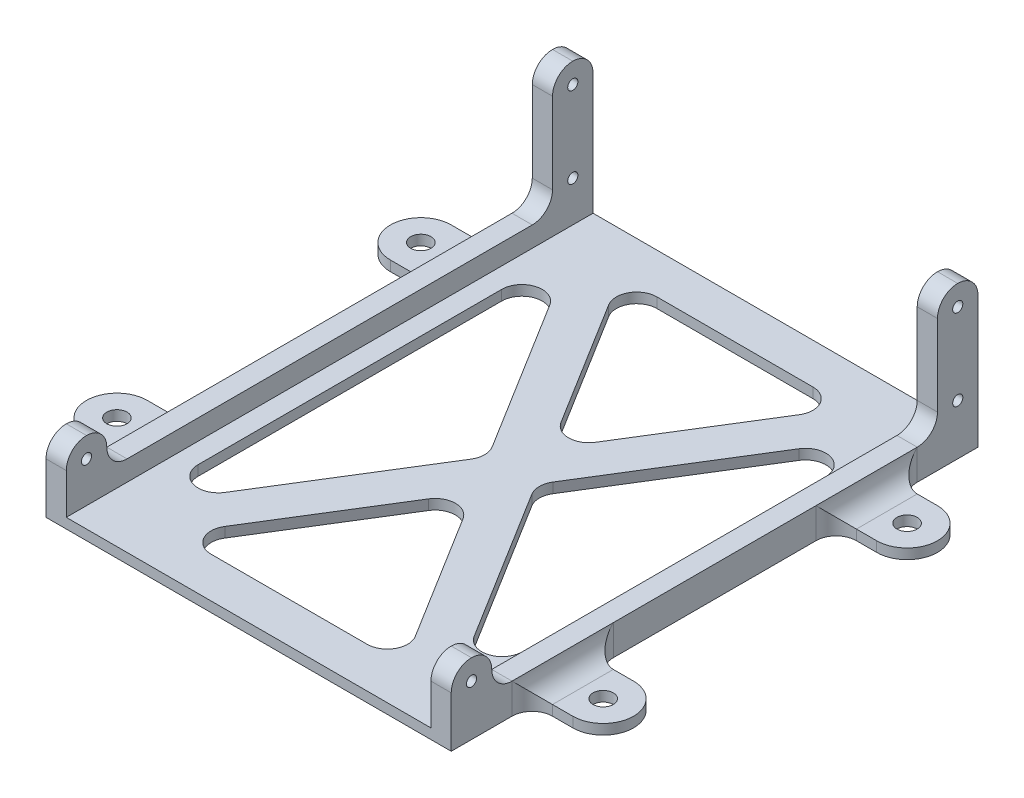
from build123d import *

# Parameters (mm, degrees)
SKETCH1_R           = 3.175
BOSS_EXTRUDE1_DEPTH = 3.175
SKETCH2_W           = 6.35
SKETCH2_H           = 165.1
BOSS_EXTRUDE3_DEPTH = 6.35
SKETCH3_W           = 6.35
SKETCH3_H           = 12.7
BOSS_EXTRUDE4_DEPTH = 12.7
SKETCH4_W           = 6.35
SKETCH4_H           = 12.7
BOSS_EXTRUDE5_DEPTH = 25.4
FILLET1_R           = 6.35
FILLET3_R           = 6.35
CUT_EXTRUDE1_REACH  = 226.748
SKETCH6_R           = 1.5875


with BuildPart() as part:
    # Sketch1 → Boss-Extrude1 (new body)
    with BuildSketch(Plane(origin=(0, 0, 0), x_dir=(1, 0, 0), z_dir=(0, 1, 0))):
        with BuildLine():
            Line((-6.35, 161.169349013), (120.65, 161.169349013))
            Line((120.65, 161.169349013), (120.65, 142.119349013))
            ThreePointArc((120.65, 142.119349013), (122.509871939, 137.629220953), (127, 135.769349013))
            Line((127, 135.769349013), (133.35, 135.769349013))
            ThreePointArc((133.35, 135.769349013), (142.875, 126.244349013), (133.35, 116.719349013))
            Line((133.35, 116.719349013), (127, 116.719349013))
            ThreePointArc((127, 116.719349013), (122.509871939, 114.859477074), (120.65, 110.369349013))
            Line((120.65, 110.369349013), (120.65, 46.869349013))
            ThreePointArc((120.65, 46.869349013), (122.509871939, 42.379220953), (127, 40.519349013))
            Line((127, 40.519349013), (133.35, 40.519349013))
            ThreePointArc((133.35, 40.519349013), (142.875, 30.994349013), (133.35, 21.469349013))
            Line((133.35, 21.469349013), (127, 21.469349013))
            ThreePointArc((127, 21.469349013), (122.509871939, 19.609477074), (120.65, 15.119349013))
            Line((120.65, 15.119349013), (120.65, -3.930650987))
            Line((120.65, -3.930650987), (-6.35, -3.930650987))
            Line((-6.35, -3.930650987), (-6.35, 15.119349013))
            ThreePointArc((-6.35, 15.119349013), (-8.209871939, 19.609477074), (-12.7, 21.469349013))
            Line((-12.7, 21.469349013), (-19.05, 21.469349013))
            ThreePointArc((-19.05, 21.469349013), (-28.575, 30.994349013), (-19.05, 40.519349013))
            Line((-19.05, 40.519349013), (-12.7, 40.519349013))
            ThreePointArc((-12.7, 40.519349013), (-8.209871939, 42.379220953), (-6.35, 46.869349013))
            Line((-6.35, 46.869349013), (-6.35, 110.369349013))
            ThreePointArc((-6.35, 110.369349013), (-8.209871939, 114.859477074), (-12.7, 116.719349013))
            Line((-12.7, 116.719349013), (-19.05, 116.719349013))
            ThreePointArc((-19.05, 116.719349013), (-28.575, 126.244349013), (-19.05, 135.769349013))
            Line((-19.05, 135.769349013), (-12.7, 135.769349013))
            ThreePointArc((-12.7, 135.769349013), (-8.209871939, 137.629220953), (-6.35, 142.119349013))
            Line((-6.35, 142.119349013), (-6.35, 161.169349013))
        make_face()
        with Locations(Location((-19.05, 126.244349013, 0), (0, 0, 270))):
            Circle(SKETCH1_R, mode=Mode.SUBTRACT)
        with Locations(Location((-19.05, 30.994349013, 0), (0, 0, 270))):
            Circle(SKETCH1_R, mode=Mode.SUBTRACT)
        with Locations(Location((133.35, 30.994349013, 0), (0, 0, 270))):
            Circle(SKETCH1_R, mode=Mode.SUBTRACT)
        with Locations(Location((133.35, 126.244349013, 0), (0, 0, 270))):
            Circle(SKETCH1_R, mode=Mode.SUBTRACT)
        with BuildLine():
            Line((81.593842457, 148.469349013), (32.706157543, 148.469349013))
            ThreePointArc((32.706157543, 148.469349013), (27.157404819, 145.207041228), (27.30998728, 138.772134277))
            Line((27.30998728, 138.772134277), (51.753829737, 99.36530019))
            ThreePointArc((51.753829737, 99.36530019), (57.15, 96.362514927), (62.546170263, 99.36530019))
            Line((62.546170263, 99.36530019), (86.99001272, 138.772134277))
            ThreePointArc((86.99001272, 138.772134277), (87.142595181, 145.207041228), (81.593842457, 148.469349013))
        make_face(mode=Mode.SUBTRACT)
        with BuildLine():
            Line((107.95, 126.185693187), (107.95, 31.05300484))
            ThreePointArc((107.95, 31.05300484), (103.340232575, 24.946116059), (96.203829737, 27.705790103))
            Line((96.203829737, 27.705790103), (66.698688048, 75.272134277))
            ThreePointArc((66.698688048, 75.272134277), (65.744858311, 78.619349013), (66.698688048, 81.96656375))
            Line((66.698688048, 81.96656375), (96.203829737, 129.532907923))
            ThreePointArc((96.203829737, 129.532907923), (103.340232575, 132.292581968), (107.95, 126.185693187))
        make_face(mode=Mode.SUBTRACT)
        with BuildLine():
            Line((81.593842457, 8.769349013), (32.706157543, 8.769349013))
            ThreePointArc((32.706157543, 8.769349013), (27.157404819, 12.031656799), (27.30998728, 18.46656375))
            Line((27.30998728, 18.46656375), (51.753829737, 57.873397836))
            ThreePointArc((51.753829737, 57.873397836), (57.15, 60.876183099), (62.546170263, 57.873397836))
            Line((62.546170263, 57.873397836), (86.99001272, 18.46656375))
            ThreePointArc((86.99001272, 18.46656375), (87.142595181, 12.031656799), (81.593842457, 8.769349013))
        make_face(mode=Mode.SUBTRACT)
        with BuildLine():
            Line((6.35, 126.185693187), (6.35, 31.05300484))
            ThreePointArc((6.35, 31.05300484), (10.959767425, 24.946116059), (18.096170263, 27.705790103))
            Line((18.096170263, 27.705790103), (47.601311952, 75.272134277))
            ThreePointArc((47.601311952, 75.272134277), (48.555141689, 78.619349013), (47.601311952, 81.96656375))
            Line((47.601311952, 81.96656375), (18.096170263, 129.532907923))
            ThreePointArc((18.096170263, 129.532907923), (10.959767425, 132.292581968), (6.35, 126.185693187))
        make_face(mode=Mode.SUBTRACT)
    extrude(amount=BOSS_EXTRUDE1_DEPTH)

    # Sketch2 → Boss-Extrude3 (add)
    with BuildSketch(Plane(origin=(0, 3.175, 0), x_dir=(1, 0, 0), z_dir=(0, 1, 0))):
        with Locations((-3.175, 78.619349013)):
            Rectangle(SKETCH2_W, SKETCH2_H)
        with Locations((117.475, 78.619349013)):
            Rectangle(SKETCH2_W, SKETCH2_H)
    extrude(amount=BOSS_EXTRUDE3_DEPTH)

    # Sketch3 → Boss-Extrude4 (add)
    with BuildSketch(Plane(origin=(0, 9.525, 0), x_dir=(1, 0, 0), z_dir=(0, 1, 0))):
        with Locations((-3.175, 154.819349013)):
            Rectangle(SKETCH3_W, SKETCH3_H)
        with Locations((117.475, 154.819349013)):
            Rectangle(SKETCH3_W, SKETCH3_H)
        with Locations((117.475, 2.419349013)):
            Rectangle(SKETCH3_W, SKETCH3_H)
        with Locations((-3.175, 2.419349013)):
            Rectangle(SKETCH3_W, SKETCH3_H)
    extrude(amount=BOSS_EXTRUDE4_DEPTH)

    # Sketch4 → Boss-Extrude5 (add)
    with BuildSketch(Plane(origin=(0, 22.225, 0), x_dir=(1, 0, 0), z_dir=(0, 1, 0))):
        with Locations((-3.175, 154.819349013)):
            Rectangle(SKETCH4_W, SKETCH4_H)
        with Locations((117.475, 154.819349013)):
            Rectangle(SKETCH4_W, SKETCH4_H)
    extrude(amount=BOSS_EXTRUDE5_DEPTH)

    # Fillet1
    fillet1_edges = [part.edges().sort_by_distance(p)[0] for p in [
        (117.475, 22.225, -8.769349013),
        (117.475, 22.225, 3.930650987),
        (-3.175, 22.225, 3.930650987),
        (-3.175, 22.225, -8.769349013),
        (117.475, 47.625, -148.469349013),
        (117.475, 47.625, -161.169349013),
        (-3.175, 47.625, -148.469349013),
        (-3.175, 47.625, -161.169349013),
        (117.475, 9.525, -148.469349013),
        (117.475, 9.525, -8.769349013),
        (-3.175, 9.525, -8.769349013),
        (-3.175, 9.525, -148.469349013),
    ]]
    fillet(fillet1_edges, radius=FILLET1_R - 0.0001)  # a hair under: the kernel refuses the full size

    # Fillet3
    fillet3_edges = [part.edges().sort_by_distance(p)[0] for p in [
        (120.65, 3.175, -30.994349013),
        (120.65, 3.175, -126.244349013),
        (-6.35, 3.175, -30.994349013),
        (-6.35, 3.175, -126.244349013),
    ]]
    fillet(fillet3_edges, radius=FILLET3_R - 0.0001)  # a hair under: the kernel refuses the full size

    # Cut-Extrude1: up to this face of the body (flat: up to its plane)
    cut_extrude1_end = Plane(part.part.faces().sort_by_distance((120.65, 4.76245, -13.401031504))[0])
    # Sketch6 → Cut-Extrude1 (cut, up to the picked face)
    with BuildSketch(Plane.ZY.offset(6.35), mode=Mode.PRIVATE) as cut_extrude1_sk1:
        with Locations((-154.819349013, 41.275)):
            Circle(SKETCH6_R)
    cut_extrude1_tool1 = split(extrude(cut_extrude1_sk1.sketch, amount=-CUT_EXTRUDE1_REACH, mode=Mode.PRIVATE), bisect_by=cut_extrude1_end, keep=Keep.BOTH, mode=Mode.PRIVATE)
    # Sketch6 → Cut-Extrude1 (cut, up to the picked face)
    with BuildSketch(Plane.ZY.offset(6.35), mode=Mode.PRIVATE) as cut_extrude1_sk2:
        with Locations((-154.819349013, 15.875)):
            Circle(SKETCH6_R)
    cut_extrude1_tool2 = split(extrude(cut_extrude1_sk2.sketch, amount=-CUT_EXTRUDE1_REACH, mode=Mode.PRIVATE), bisect_by=cut_extrude1_end, keep=Keep.BOTH, mode=Mode.PRIVATE)
    # Sketch6 → Cut-Extrude1 (cut, up to the picked face)
    with BuildSketch(Plane.ZY.offset(6.35), mode=Mode.PRIVATE) as cut_extrude1_sk3:
        with Locations((-2.419349013, 15.875)):
            Circle(SKETCH6_R)
    cut_extrude1_tool3 = split(extrude(cut_extrude1_sk3.sketch, amount=-CUT_EXTRUDE1_REACH, mode=Mode.PRIVATE), bisect_by=cut_extrude1_end, keep=Keep.BOTH, mode=Mode.PRIVATE)
    add(cut_extrude1_tool1.solids().sort_by(Axis((-6.35, 41.275, -154.819349), (1, 0, 0)))[0], mode=Mode.SUBTRACT)
    add(cut_extrude1_tool2.solids().sort_by(Axis((-6.35, 15.875, -154.819349), (1, 0, 0)))[0], mode=Mode.SUBTRACT)
    add(cut_extrude1_tool3.solids().sort_by(Axis((-6.35, 15.875, -2.419349), (1, 0, 0)))[0], mode=Mode.SUBTRACT)


solid = part.part
